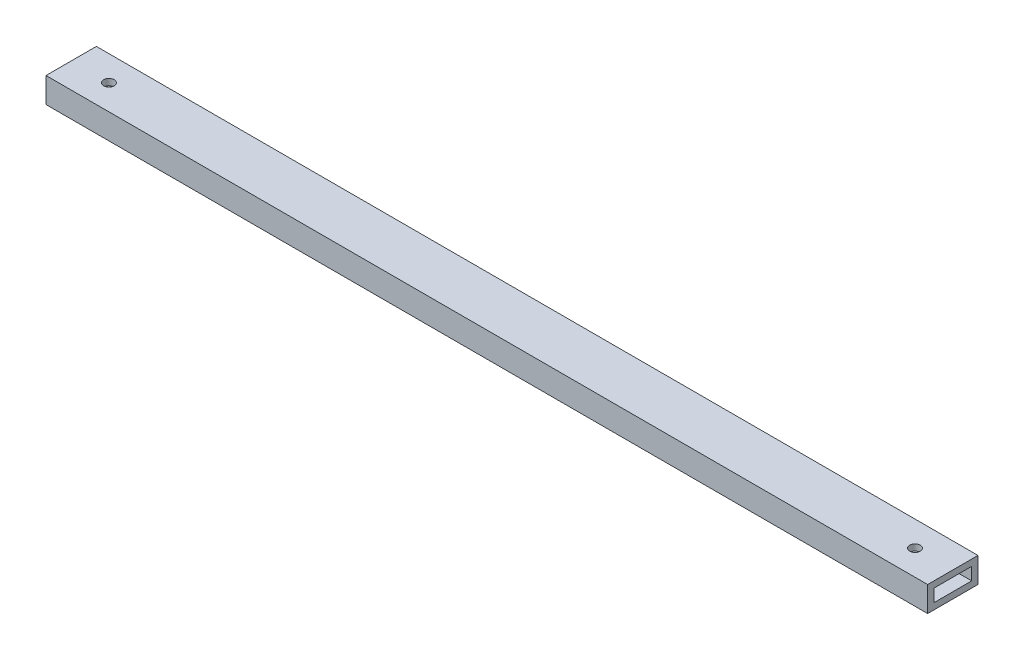
from build123d import *

# Parameters (mm, degrees)
SKETCH1_W           = 25.4
SKETCH1_H           = 12.7
SKETCH1_W_2         = 19.05
SKETCH1_H_2         = 6.35
BOSS_EXTRUDE1_DEPTH = 444.5
SKETCH2_R           = 2.667
CUT_EXTRUDE1_DEPTH  = 446.406219085


with BuildPart() as part:
    # Sketch1 → Boss-Extrude1 (new body)
    with BuildSketch(Plane(origin=(0, 0, 0), x_dir=(0, 0, -1), z_dir=(1, 0, 0))):
        with Locations((12.7, 6.35)):
            Rectangle(SKETCH1_W, SKETCH1_H)
        with Locations((12.7, 6.35)):
            Rectangle(SKETCH1_W_2, SKETCH1_H_2, mode=Mode.SUBTRACT)
    extrude(amount=BOSS_EXTRUDE1_DEPTH)

    # Sketch2 → Cut-Extrude1 (cut, through all)
    with BuildSketch(Plane(origin=(0, 12.7, 0), x_dir=(1, 0, 0), z_dir=(0, 1, 0))):
        with Locations((19.05, 12.7)):
            Circle(SKETCH2_R)
        with Locations((425.45, 12.7)):
            Circle(SKETCH2_R)
    extrude(amount=-CUT_EXTRUDE1_DEPTH, mode=Mode.SUBTRACT)


solid = part.part
